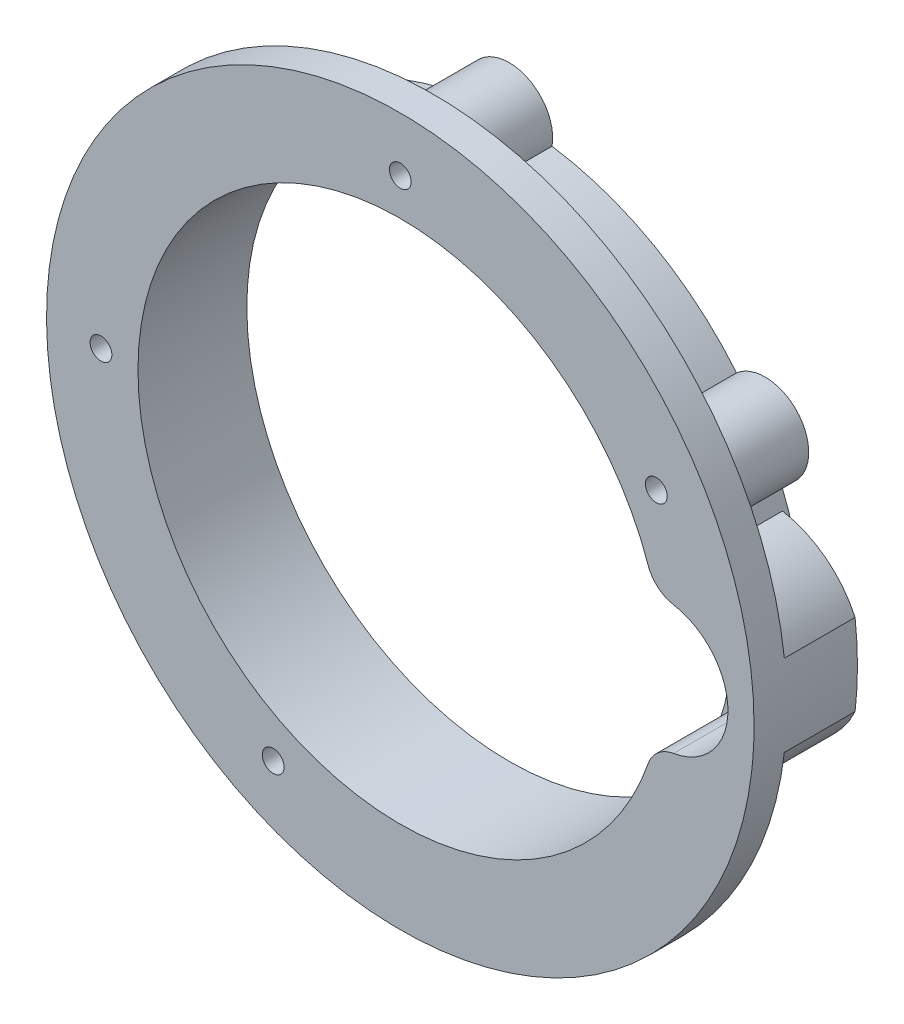
from build123d import *

# Parameters (mm, degrees)
SKETCH1_R                = 32.5
SKETCH1_R_2              = 24.1
SKETCH1_R_3              = 1
RING_BODY_DEPTH          = 10
SKETCH2_R                = 6
NUB_CUT_DEPTH            = 6.5
NUB_CUT_FILLETS_3MM_R    = 3
WEIGHT_REDUCTION_DEPTH   = 7
WEIGHT_REDUCTION_2_DEPTH = 0.5


# Read off the part's stored shape, not the designer's step: Weight reduction
with BuildPart() as part:
    # Sketch1 → Ring body (new body)
    with BuildSketch(Plane.XY):
        Circle(SKETCH1_R)
        Circle(SKETCH1_R_2, mode=Mode.SUBTRACT)
        with Locations((0, 27.5)):
            Circle(SKETCH1_R_3, mode=Mode.SUBTRACT)
        with Locations((23.5226917, 14.245454545)):
            Circle(SKETCH1_R_3, mode=Mode.SUBTRACT)
        with Locations((-27.5, 0)):
            Circle(SKETCH1_R_3, mode=Mode.SUBTRACT)
        with Locations((-11.677272727, -24.897616385)):
            Circle(SKETCH1_R_3, mode=Mode.SUBTRACT)
    extrude(amount=RING_BODY_DEPTH)

    # Sketch2 → Nub cut (cut)
    with BuildSketch(Plane.XY.offset(10)):
        with Locations((24.1, 0)):
            Circle(SKETCH2_R)
    extrude(amount=-NUB_CUT_DEPTH, mode=Mode.SUBTRACT)

    # Nub cut fillets 3mm
    nub_cut_fillets_3mm_edges = [part.edges().sort_by_distance(p)[0] for p in [
        (23.353112033, 5.953331703, 6.75),
        (23.353112033, -5.953331703, 6.75),
    ]]
    fillet(nub_cut_fillets_3mm_edges, radius=NUB_CUT_FILLETS_3MM_R)

    # Weight reduction outline → Weight reduction (cut)
    with BuildSketch(Plane.XY):
        with BuildLine():
            ThreePointArc((32.28340249, -3.745920941), (29.581251517, -7.138338869), (25.606224066, -8.87306537))
            ThreePointArc((25.606224066, -8.87306537), (12.328674894, -24.13325041), (-7.817628093, -25.947922672))
            ThreePointArc((-7.817628093, -25.947922672), (-13.375785124, -28.519087859), (-14.952629097, -22.601523911))
            ThreePointArc((-14.952629097, -22.601523911), (-22.872047594, -14.535454545), (-26.812, -3.940387798))
            ThreePointArc((-26.812, -3.940387798), (-31.5, 0), (-26.812, 3.940387798))
            ThreePointArc((-26.812, 3.940387798), (-19.16259377, 19.16259377), (-3.940387798, 26.812))
            ThreePointArc((-3.940387798, 26.812), (0, 31.5), (3.940387798, 26.812))
            ThreePointArc((3.940387798, 26.812), (13.303636364, 23.60981278), (20.893010712, 17.259551077))
            ThreePointArc((20.893010712, 17.259551077), (26.944174129, 16.317520661), (24.975382732, 10.51856727))
            ThreePointArc((24.975382732, 10.51856727), (25.304182573, 9.700945537), (25.606224067, 8.87306537))
            ThreePointArc((25.606224067, 8.87306537), (29.581251517, 7.138338869), (32.28340249, 3.745920941))
            ThreePointArc((32.28340249, 3.745920941), (-32.5, 0), (32.28340249, -3.745920941))
        make_face()
    extrude(amount=WEIGHT_REDUCTION_DEPTH, mode=Mode.SUBTRACT)

    # Weight reduction 2 outline → Weight reduction 2 (cut)
    with BuildSketch(Plane.XY):
        with BuildLine():
            ThreePointArc((25.606224067, 8.87306537), (27.1, 0), (25.606224066, -8.87306537))
            ThreePointArc((25.606224066, -8.87306537), (29.581251517, -7.138338869), (32.28340249, -3.745920941))
            ThreePointArc((32.28340249, -3.745920941), (32.5, 0), (32.28340249, 3.745920941))
            ThreePointArc((32.28340249, 3.745920941), (29.581251517, 7.138338869), (25.606224067, 8.87306537))
        make_face()
    extrude(amount=WEIGHT_REDUCTION_2_DEPTH, mode=Mode.SUBTRACT)


solid = part.part
